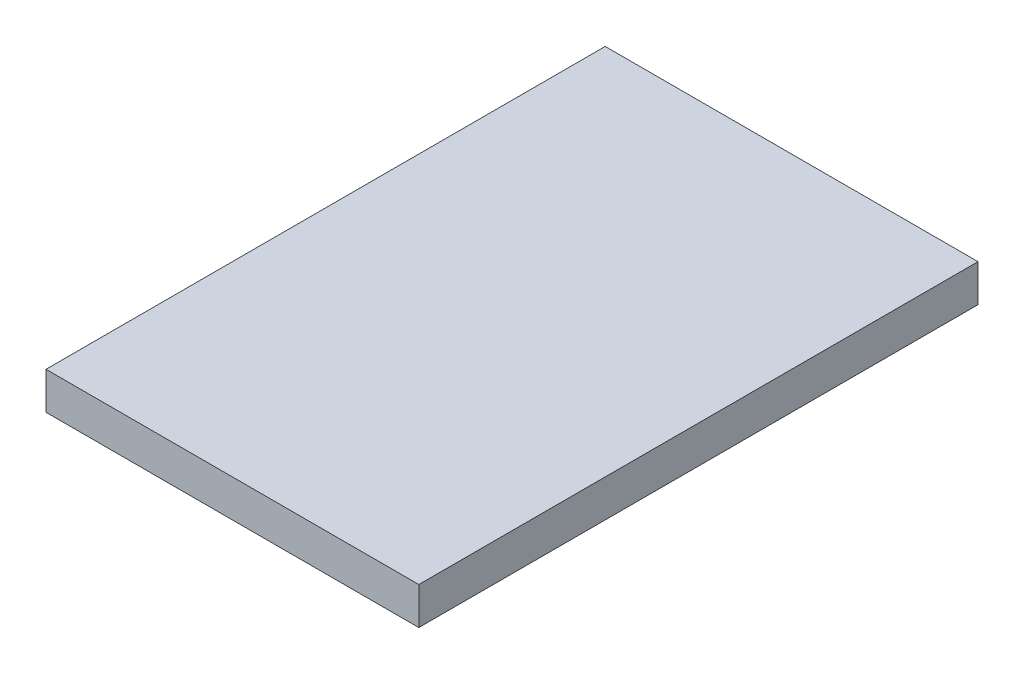
from build123d import *

# Parameters (mm, degrees)
SKETCH1_W            = 49
SKETCH1_H            = 101
BOSS_EXTRUDE1_DEPTH  = 1.5
SKETCH2_W            = 54
SKETCH2_H            = 106
SKETCH2_W_2          = 49
SKETCH2_H_2          = 101
BOSS_EXTRUDE2_DEPTH  = 4
BOSS_EXTRUDE3_DEPTH  = 4
SKETCH8_W            = 5
SKETCH8_H            = 15
BOSS_EXTRUDE4_DEPTH  = 3.5
FILLET3_R            = 4
FILLET3_OF_MIRROR1_R = 4
SKETCH4_R            = 1.75
CUT_EXTRUDE1_DEPTH   = 1
SKETCH5_R            = 1.75
CUT_EXTRUDE2_DEPTH   = 1
FILLET1_R            = 3
FILLET2_R            = 10
CHAMFER1_SIZE        = 1
CHAMFER2_SIZE        = 1
FILLET4_R            = 2
FILLET6_R            = 4
FILLET5_R            = 1
SKETCH9_W            = 100
SKETCH9_H            = 150
BOSS_EXTRUDE5_DEPTH  = 10
SCALE1_SCALE         = 0.99
CHAMFER3_SIZE        = 3


# Some blends are built 0.0001 mm under size
with BuildPart() as part:
    # Sketch1 → Boss-Extrude1 (new body)
    with BuildSketch(Plane(origin=(0, 0, 0), x_dir=(1, 0, 0), z_dir=(0, 1, 0))):
        Rectangle(SKETCH1_W, SKETCH1_H)
    extrude(amount=BOSS_EXTRUDE1_DEPTH)

    # Sketch2 → Boss-Extrude2 (add)
    with BuildSketch(Plane(origin=(0, 0, 0), x_dir=(1, 0, 0), z_dir=(0, 1, 0))):
        Rectangle(SKETCH2_W, SKETCH2_H)
        Rectangle(SKETCH2_W_2, SKETCH2_H_2, mode=Mode.SUBTRACT)
    extrude(amount=BOSS_EXTRUDE2_DEPTH)

    # Sketch3 → Boss-Extrude3 (add)
    with BuildSketch(Plane(origin=(0, 0, 0), x_dir=(1, 0, 0), z_dir=(0, 1, 0))):
        with BuildLine():
            Line((-24.5, -30.741687605), (-24.5, -34.058312395))
            ThreePointArc((-24.5, -34.058312395), (-19, -32.4), (-24.5, -30.741687605))
        make_face()
        with BuildLine():
            Line((-24.5, -46.403337045), (-24.5, -50.5))
            Line((-24.5, -50.5), (-20.403337045, -50.5))
            ThreePointArc((-20.403337045, -50.5), (-19.778679656, -45.778679656), (-24.5, -46.403337045))
        make_face()
    boss_extrude3 = extrude(amount=BOSS_EXTRUDE3_DEPTH)

    # Sketch8 → Boss-Extrude4 (add)
    with BuildSketch(Plane(origin=(0, 1.5, 0), x_dir=(1, 0, 0), z_dir=(0, 1, 0))):
        with Locations((-12.25, 0)):
            Rectangle(SKETCH8_W, SKETCH8_H)
    boss_extrude4 = extrude(amount=BOSS_EXTRUDE4_DEPTH)

    # Fillet3
    # the kernel refuses this fillet: 4 mm, written as the material it adds along each edge
    with BuildSketch(Plane(origin=(-14.75, 1.5, -7.5), x_dir=(0, 0, -1), z_dir=(1, 0, 0)), Plane(origin=(-9.75, 1.5, 7.5), x_dir=(0, 0, 1), z_dir=(-1, 0, 0))) as fillet3_piece_1:
        with BuildLine():
            CenterArc((3.968626967, 4), FILLET3_R, 187.180755781, 82.819244219)
            Line((0, 3.5), (-0.079372539, 3.49))
            ThreePointArc((-0.079372539, 3.49), (-0.08, 1.75), (-0.08, 0))
            Line((-0.08, 0), (0, -0.08))
            Line((0, -0.08), (3.968626967, -0.08))
            Line((3.968626967, -0.08), (3.968626967, 0))
        make_face()
    extrude(amount=5)
    with BuildSketch(Plane(origin=(-9.75, 1.5, -7.5), x_dir=(1, 0, 0), z_dir=(0, 0, 1)), Plane(origin=(-14.75, 1.5, 7.5), x_dir=(-1, 0, 0), z_dir=(0, 0, -1))) as fillet3_piece_2:
        with BuildLine():
            CenterArc((3.968626967, 4), FILLET3_R, 187.180755781, 82.819244219)
            Line((0, 3.5), (-0.079372539, 3.49))
            ThreePointArc((-0.079372539, 3.49), (-0.08, 1.75), (-0.08, 0))
            Line((-0.08, 0), (0, -0.08))
            Line((0, -0.08), (3.968626967, -0.08))
            Line((3.968626967, -0.08), (3.968626967, 0))
        make_face()
    extrude(amount=15)
    with BuildSketch(Plane(origin=(-14.75, 1.5, 7.5), x_dir=(-1, 0, 0), z_dir=(0, 0, -1))) as fillet3_piece_3a_section:
        with BuildLine():
            CenterArc((3.968626967, 4), FILLET3_R, 187.180755781, 82.819244219)
            Line((0, 3.5), (-0.079372539, 3.49))
            ThreePointArc((-0.079372539, 3.49), (-0.08, 1.75), (-0.08, 0))
            Line((-0.08, 0), (0, -0.08))
            Line((0, -0.08), (3.968626967, -0.08))
            Line((3.968626967, -0.08), (3.968626967, 0))
        make_face()
    fillet3_piece_3a = extrude(amount=24.921567416, mode=Mode.PRIVATE)
    fillet3_piece_3a = split(fillet3_piece_3a, bisect_by=Plane(origin=(-15.663794772, 2.350141375, -7.5), z_dir=(0, 0, -1)), keep=Keep.TOP, mode=Mode.PRIVATE)
    with BuildSketch(Plane(origin=(-24.671567416, 1.5, -7.5), x_dir=(0, 0, -1), z_dir=(1, 0, 0))) as fillet3_piece_3b_section:
        with BuildLine():
            CenterArc((3.968626967, 4), FILLET3_R, 187.180755781, 82.819244219)
            Line((0, 3.5), (-0.079372539, 3.49))
            ThreePointArc((-0.079372539, 3.49), (-0.08, 1.75), (-0.08, 0))
            Line((-0.08, 0), (0, -0.08))
            Line((0, -0.08), (3.968626967, -0.08))
            Line((3.968626967, -0.08), (3.968626967, 0))
        make_face()
    fillet3_piece_3b = extrude(amount=14.921567416, mode=Mode.PRIVATE)
    fillet3_piece_3b = split(fillet3_piece_3b, bisect_by=Plane(origin=(-14.75, 2.350141375, -8.413794772), z_dir=(-1, 0, 0)), keep=Keep.TOP, mode=Mode.PRIVATE)
    fillet3_piece_3 = fillet3_piece_3a & fillet3_piece_3b
    add(fillet3_piece_3)
    with BuildSketch(Plane(origin=(-9.75, 1.5, -17.421567416), x_dir=(1, 0, 0), z_dir=(0, 0, 1))) as fillet3_piece_4a_section:
        with BuildLine():
            CenterArc((3.968626967, 4), FILLET3_R, 187.180755781, 82.819244219)
            Line((0, 3.5), (-0.079372539, 3.49))
            ThreePointArc((-0.079372539, 3.49), (-0.08, 1.75), (-0.08, 0))
            Line((-0.08, 0), (0, -0.08))
            Line((0, -0.08), (3.968626967, -0.08))
            Line((3.968626967, -0.08), (3.968626967, 0))
        make_face()
    fillet3_piece_4a = extrude(amount=24.921567416, mode=Mode.PRIVATE)
    fillet3_piece_4a = split(fillet3_piece_4a, bisect_by=Plane(origin=(-8.836205228, 2.350141375, -7.5), z_dir=(0, 0, -1)), keep=Keep.TOP, mode=Mode.PRIVATE)
    with BuildSketch(Plane(origin=(-14.75, 1.5, -7.5), x_dir=(0, 0, -1), z_dir=(1, 0, 0))) as fillet3_piece_4b_section:
        with BuildLine():
            CenterArc((3.968626967, 4), FILLET3_R, 187.180755781, 82.819244219)
            Line((0, 3.5), (-0.079372539, 3.49))
            ThreePointArc((-0.079372539, 3.49), (-0.08, 1.75), (-0.08, 0))
            Line((-0.08, 0), (0, -0.08))
            Line((0, -0.08), (3.968626967, -0.08))
            Line((3.968626967, -0.08), (3.968626967, 0))
        make_face()
    fillet3_piece_4b = extrude(amount=14.921567416, mode=Mode.PRIVATE)
    fillet3_piece_4b = split(fillet3_piece_4b, bisect_by=Plane(origin=(-9.75, 2.350141375, -8.413794772), z_dir=(1, 0, 0)), keep=Keep.TOP, mode=Mode.PRIVATE)
    fillet3_piece_4 = fillet3_piece_4a & fillet3_piece_4b
    add(fillet3_piece_4)
    with BuildSketch(Plane(origin=(0.171567416, 1.5, 7.5), x_dir=(0, 0, 1), z_dir=(-1, 0, 0))) as fillet3_piece_5a_section:
        with BuildLine():
            CenterArc((3.968626967, 4), FILLET3_R, 187.180755781, 82.819244219)
            Line((0, 3.5), (-0.079372539, 3.49))
            ThreePointArc((-0.079372539, 3.49), (-0.08, 1.75), (-0.08, 0))
            Line((-0.08, 0), (0, -0.08))
            Line((0, -0.08), (3.968626967, -0.08))
            Line((3.968626967, -0.08), (3.968626967, 0))
        make_face()
    fillet3_piece_5a = extrude(amount=14.921567416, mode=Mode.PRIVATE)
    fillet3_piece_5a = split(fillet3_piece_5a, bisect_by=Plane(origin=(-9.75, 2.350141375, 8.413794772), z_dir=(1, 0, 0)), keep=Keep.TOP, mode=Mode.PRIVATE)
    with BuildSketch(Plane(origin=(-9.75, 1.5, -7.5), x_dir=(1, 0, 0), z_dir=(0, 0, 1))) as fillet3_piece_5b_section:
        with BuildLine():
            CenterArc((3.968626967, 4), FILLET3_R, 187.180755781, 82.819244219)
            Line((0, 3.5), (-0.079372539, 3.49))
            ThreePointArc((-0.079372539, 3.49), (-0.08, 1.75), (-0.08, 0))
            Line((-0.08, 0), (0, -0.08))
            Line((0, -0.08), (3.968626967, -0.08))
            Line((3.968626967, -0.08), (3.968626967, 0))
        make_face()
    fillet3_piece_5b = extrude(amount=24.921567416, mode=Mode.PRIVATE)
    fillet3_piece_5b = split(fillet3_piece_5b, bisect_by=Plane(origin=(-8.836205228, 2.350141375, 7.5), z_dir=(0, 0, 1)), keep=Keep.TOP, mode=Mode.PRIVATE)
    fillet3_piece_5 = fillet3_piece_5a & fillet3_piece_5b
    add(fillet3_piece_5)
    with BuildSketch(Plane(origin=(-14.75, 1.5, 17.421567416), x_dir=(-1, 0, 0), z_dir=(0, 0, -1))) as fillet3_piece_6a_section:
        with BuildLine():
            CenterArc((3.968626967, 4), FILLET3_R, 187.180755781, 82.819244219)
            Line((0, 3.5), (-0.079372539, 3.49))
            ThreePointArc((-0.079372539, 3.49), (-0.08, 1.75), (-0.08, 0))
            Line((-0.08, 0), (0, -0.08))
            Line((0, -0.08), (3.968626967, -0.08))
            Line((3.968626967, -0.08), (3.968626967, 0))
        make_face()
    fillet3_piece_6a = extrude(amount=24.921567416, mode=Mode.PRIVATE)
    fillet3_piece_6a = split(fillet3_piece_6a, bisect_by=Plane(origin=(-15.663794772, 2.350141375, 7.5), z_dir=(0, 0, 1)), keep=Keep.TOP, mode=Mode.PRIVATE)
    with BuildSketch(Plane(origin=(-9.75, 1.5, 7.5), x_dir=(0, 0, 1), z_dir=(-1, 0, 0))) as fillet3_piece_6b_section:
        with BuildLine():
            CenterArc((3.968626967, 4), FILLET3_R, 187.180755781, 82.819244219)
            Line((0, 3.5), (-0.079372539, 3.49))
            ThreePointArc((-0.079372539, 3.49), (-0.08, 1.75), (-0.08, 0))
            Line((-0.08, 0), (0, -0.08))
            Line((0, -0.08), (3.968626967, -0.08))
            Line((3.968626967, -0.08), (3.968626967, 0))
        make_face()
    fillet3_piece_6b = extrude(amount=14.921567416, mode=Mode.PRIVATE)
    fillet3_piece_6b = split(fillet3_piece_6b, bisect_by=Plane(origin=(-14.75, 2.350141375, 8.413794772), z_dir=(-1, 0, 0)), keep=Keep.TOP, mode=Mode.PRIVATE)
    fillet3_piece_6 = fillet3_piece_6a & fillet3_piece_6b
    add(fillet3_piece_6)

    # Mirror1: Boss-Extrude3, Boss-Extrude4 across plane
    add(boss_extrude3.mirror(Plane(origin=(0, 0, 0), x_dir=(0, 0, 1), z_dir=(1, 0, 0))))
    add(boss_extrude4.mirror(Plane(origin=(0, 0, 0), x_dir=(0, 0, 1), z_dir=(1, 0, 0))))

    # Fillet3 of Mirror1
    # the kernel refuses this fillet: 4 mm, written as the material it adds along each edge
    with BuildSketch(Plane(origin=(14.75, 1.5, -7.5), x_dir=(0, 0, -1), z_dir=(-1, 0, 0)), Plane(origin=(9.75, 1.5, 7.5), x_dir=(0, 0, 1), z_dir=(1, 0, 0))) as fillet3_of_mirror1_piece_1:
        with BuildLine():
            CenterArc((3.968626967, -4), FILLET3_OF_MIRROR1_R, 90, 82.819244219)
            Line((0, -3.5), (-0.079372539, -3.49))
            ThreePointArc((-0.079372539, -3.49), (-0.08, -1.75), (-0.08, 0))
            Line((-0.08, 0), (0, 0.08))
            Line((0, 0.08), (3.968626967, 0.08))
            Line((3.968626967, 0.08), (3.968626967, 0))
        make_face()
    extrude(amount=5)
    with BuildSketch(Plane(origin=(9.75, 1.5, -7.5), x_dir=(-1, 0, 0), z_dir=(0, 0, 1)), Plane(origin=(14.75, 1.5, 7.5), x_dir=(1, 0, 0), z_dir=(0, 0, -1))) as fillet3_of_mirror1_piece_2:
        with BuildLine():
            CenterArc((3.968626967, -4), FILLET3_OF_MIRROR1_R, 90, 82.819244219)
            Line((0, -3.5), (-0.079372539, -3.49))
            ThreePointArc((-0.079372539, -3.49), (-0.08, -1.75), (-0.08, 0))
            Line((-0.08, 0), (0, 0.08))
            Line((0, 0.08), (3.968626967, 0.08))
            Line((3.968626967, 0.08), (3.968626967, 0))
        make_face()
    extrude(amount=15)
    with BuildSketch(Plane(origin=(24.671567416, 1.5, -7.5), x_dir=(0, 0, -1), z_dir=(-1, 0, 0))) as fillet3_of_mirror1_piece_3a_section:
        with BuildLine():
            CenterArc((3.968626967, -4), FILLET3_OF_MIRROR1_R, 90, 82.819244219)
            Line((0, -3.5), (-0.079372539, -3.49))
            ThreePointArc((-0.079372539, -3.49), (-0.08, -1.75), (-0.08, 0))
            Line((-0.08, 0), (0, 0.08))
            Line((0, 0.08), (3.968626967, 0.08))
            Line((3.968626967, 0.08), (3.968626967, 0))
        make_face()
    fillet3_of_mirror1_piece_3a = extrude(amount=14.921567416, mode=Mode.PRIVATE)
    fillet3_of_mirror1_piece_3a = split(fillet3_of_mirror1_piece_3a, bisect_by=Plane(origin=(14.75, 2.350141375, -8.413794772), z_dir=(1, 0, 0)), keep=Keep.TOP, mode=Mode.PRIVATE)
    with BuildSketch(Plane(origin=(14.75, 1.5, 7.5), x_dir=(1, 0, 0), z_dir=(0, 0, -1))) as fillet3_of_mirror1_piece_3b_section:
        with BuildLine():
            CenterArc((3.968626967, -4), FILLET3_OF_MIRROR1_R, 90, 82.819244219)
            Line((0, -3.5), (-0.079372539, -3.49))
            ThreePointArc((-0.079372539, -3.49), (-0.08, -1.75), (-0.08, 0))
            Line((-0.08, 0), (0, 0.08))
            Line((0, 0.08), (3.968626967, 0.08))
            Line((3.968626967, 0.08), (3.968626967, 0))
        make_face()
    fillet3_of_mirror1_piece_3b = extrude(amount=24.921567416, mode=Mode.PRIVATE)
    fillet3_of_mirror1_piece_3b = split(fillet3_of_mirror1_piece_3b, bisect_by=Plane(origin=(15.663794772, 2.350141375, -7.5), z_dir=(0, 0, -1)), keep=Keep.TOP, mode=Mode.PRIVATE)
    fillet3_of_mirror1_piece_3 = fillet3_of_mirror1_piece_3a & fillet3_of_mirror1_piece_3b
    add(fillet3_of_mirror1_piece_3)
    with BuildSketch(Plane(origin=(14.75, 1.5, -7.5), x_dir=(0, 0, -1), z_dir=(-1, 0, 0))) as fillet3_of_mirror1_piece_4a_section:
        with BuildLine():
            CenterArc((3.968626967, -4), FILLET3_OF_MIRROR1_R, 90, 82.819244219)
            Line((0, -3.5), (-0.079372539, -3.49))
            ThreePointArc((-0.079372539, -3.49), (-0.08, -1.75), (-0.08, 0))
            Line((-0.08, 0), (0, 0.08))
            Line((0, 0.08), (3.968626967, 0.08))
            Line((3.968626967, 0.08), (3.968626967, 0))
        make_face()
    fillet3_of_mirror1_piece_4a = extrude(amount=14.921567416, mode=Mode.PRIVATE)
    fillet3_of_mirror1_piece_4a = split(fillet3_of_mirror1_piece_4a, bisect_by=Plane(origin=(9.75, 2.350141375, -8.413794772), z_dir=(-1, 0, 0)), keep=Keep.TOP, mode=Mode.PRIVATE)
    with BuildSketch(Plane(origin=(9.75, 1.5, -17.421567416), x_dir=(-1, 0, 0), z_dir=(0, 0, 1))) as fillet3_of_mirror1_piece_4b_section:
        with BuildLine():
            CenterArc((3.968626967, -4), FILLET3_OF_MIRROR1_R, 90, 82.819244219)
            Line((0, -3.5), (-0.079372539, -3.49))
            ThreePointArc((-0.079372539, -3.49), (-0.08, -1.75), (-0.08, 0))
            Line((-0.08, 0), (0, 0.08))
            Line((0, 0.08), (3.968626967, 0.08))
            Line((3.968626967, 0.08), (3.968626967, 0))
        make_face()
    fillet3_of_mirror1_piece_4b = extrude(amount=24.921567416, mode=Mode.PRIVATE)
    fillet3_of_mirror1_piece_4b = split(fillet3_of_mirror1_piece_4b, bisect_by=Plane(origin=(8.836205228, 2.350141375, -7.5), z_dir=(0, 0, -1)), keep=Keep.TOP, mode=Mode.PRIVATE)
    fillet3_of_mirror1_piece_4 = fillet3_of_mirror1_piece_4a & fillet3_of_mirror1_piece_4b
    add(fillet3_of_mirror1_piece_4)
    with BuildSketch(Plane(origin=(9.75, 1.5, -7.5), x_dir=(-1, 0, 0), z_dir=(0, 0, 1))) as fillet3_of_mirror1_piece_5a_section:
        with BuildLine():
            CenterArc((3.968626967, -4), FILLET3_OF_MIRROR1_R, 90, 82.819244219)
            Line((0, -3.5), (-0.079372539, -3.49))
            ThreePointArc((-0.079372539, -3.49), (-0.08, -1.75), (-0.08, 0))
            Line((-0.08, 0), (0, 0.08))
            Line((0, 0.08), (3.968626967, 0.08))
            Line((3.968626967, 0.08), (3.968626967, 0))
        make_face()
    fillet3_of_mirror1_piece_5a = extrude(amount=24.921567416, mode=Mode.PRIVATE)
    fillet3_of_mirror1_piece_5a = split(fillet3_of_mirror1_piece_5a, bisect_by=Plane(origin=(8.836205228, 2.350141375, 7.5), z_dir=(0, 0, 1)), keep=Keep.TOP, mode=Mode.PRIVATE)
    with BuildSketch(Plane(origin=(-0.171567416, 1.5, 7.5), x_dir=(0, 0, 1), z_dir=(1, 0, 0))) as fillet3_of_mirror1_piece_5b_section:
        with BuildLine():
            CenterArc((3.968626967, -4), FILLET3_OF_MIRROR1_R, 90, 82.819244219)
            Line((0, -3.5), (-0.079372539, -3.49))
            ThreePointArc((-0.079372539, -3.49), (-0.08, -1.75), (-0.08, 0))
            Line((-0.08, 0), (0, 0.08))
            Line((0, 0.08), (3.968626967, 0.08))
            Line((3.968626967, 0.08), (3.968626967, 0))
        make_face()
    fillet3_of_mirror1_piece_5b = extrude(amount=14.921567416, mode=Mode.PRIVATE)
    fillet3_of_mirror1_piece_5b = split(fillet3_of_mirror1_piece_5b, bisect_by=Plane(origin=(9.75, 2.350141375, 8.413794772), z_dir=(-1, 0, 0)), keep=Keep.TOP, mode=Mode.PRIVATE)
    fillet3_of_mirror1_piece_5 = fillet3_of_mirror1_piece_5a & fillet3_of_mirror1_piece_5b
    add(fillet3_of_mirror1_piece_5)
    with BuildSketch(Plane(origin=(9.75, 1.5, 7.5), x_dir=(0, 0, 1), z_dir=(1, 0, 0))) as fillet3_of_mirror1_piece_6a_section:
        with BuildLine():
            CenterArc((3.968626967, -4), FILLET3_OF_MIRROR1_R, 90, 82.819244219)
            Line((0, -3.5), (-0.079372539, -3.49))
            ThreePointArc((-0.079372539, -3.49), (-0.08, -1.75), (-0.08, 0))
            Line((-0.08, 0), (0, 0.08))
            Line((0, 0.08), (3.968626967, 0.08))
            Line((3.968626967, 0.08), (3.968626967, 0))
        make_face()
    fillet3_of_mirror1_piece_6a = extrude(amount=14.921567416, mode=Mode.PRIVATE)
    fillet3_of_mirror1_piece_6a = split(fillet3_of_mirror1_piece_6a, bisect_by=Plane(origin=(14.75, 2.350141375, 8.413794772), z_dir=(1, 0, 0)), keep=Keep.TOP, mode=Mode.PRIVATE)
    with BuildSketch(Plane(origin=(14.75, 1.5, 17.421567416), x_dir=(1, 0, 0), z_dir=(0, 0, -1))) as fillet3_of_mirror1_piece_6b_section:
        with BuildLine():
            CenterArc((3.968626967, -4), FILLET3_OF_MIRROR1_R, 90, 82.819244219)
            Line((0, -3.5), (-0.079372539, -3.49))
            ThreePointArc((-0.079372539, -3.49), (-0.08, -1.75), (-0.08, 0))
            Line((-0.08, 0), (0, 0.08))
            Line((0, 0.08), (3.968626967, 0.08))
            Line((3.968626967, 0.08), (3.968626967, 0))
        make_face()
    fillet3_of_mirror1_piece_6b = extrude(amount=24.921567416, mode=Mode.PRIVATE)
    fillet3_of_mirror1_piece_6b = split(fillet3_of_mirror1_piece_6b, bisect_by=Plane(origin=(15.663794772, 2.350141375, 7.5), z_dir=(0, 0, 1)), keep=Keep.TOP, mode=Mode.PRIVATE)
    fillet3_of_mirror1_piece_6 = fillet3_of_mirror1_piece_6a & fillet3_of_mirror1_piece_6b
    add(fillet3_of_mirror1_piece_6)

    # Sketch4 → Cut-Extrude1 (cut)
    with BuildSketch(Plane(origin=(0, 4, 0), x_dir=(1, 0, 0), z_dir=(0, 1, 0))):
        with Locations(Location((-21.9, -47.9, 0), (0, 0, 270))):
            Circle(SKETCH4_R)
        with Locations(Location((21.9, -47.9, 0), (0, 0, 270))):
            Circle(SKETCH4_R)
    extrude(amount=-CUT_EXTRUDE1_DEPTH, mode=Mode.SUBTRACT)

    # Sketch5 → Cut-Extrude2 (cut)
    with BuildSketch(Plane(origin=(0, 4, 0), x_dir=(1, 0, 0), z_dir=(0, 1, 0))):
        with Locations(Location((-22, -32.4, 0), (0, 0, 270))):
            Circle(SKETCH5_R)
        with Locations(Location((22, -32.4, 0), (0, 0, 270))):
            Circle(SKETCH5_R)
    extrude(amount=-CUT_EXTRUDE2_DEPTH, mode=Mode.SUBTRACT)

    # Fillet1
    fillet1_edges = [part.edges().sort_by_distance(p)[0] for p in [
        (-27, 2, 53),
        (27, 2, 53),
        (27, 2, -53),
        (-27, 2, -53),
    ]]
    fillet(fillet1_edges, radius=FILLET1_R)

    # Fillet2
    fillet2_edges = [part.edges().sort_by_distance(p)[0] for p in [
        (24.5, 2.75, 34.058312395),
        (24.5, 2.75, 30.741687605),
        (-24.5, 2.75, 34.058312395),
        (-24.5, 2.75, 30.741687605),
    ]]
    fillet(fillet2_edges, radius=FILLET2_R)

    # Chamfer1
    chamfer1_edges = [part.edges().sort_by_distance(p)[0] for p in [
        (-22, 3, 30.65),
        (22, 3, 30.65),
    ]]
    chamfer(chamfer1_edges, length=CHAMFER1_SIZE - 0.0001)  # a hair under: the kernel refuses the full size

    # Chamfer2
    chamfer2_edges = [part.edges().sort_by_distance(p)[0] for p in [
        (-21.9, 3, 46.15),
        (21.9, 3, 46.15),
    ]]
    chamfer(chamfer2_edges, length=CHAMFER2_SIZE - 0.0001)  # a hair under: the kernel refuses the full size

    # Fillet4
    fillet4_edges = [part.edges().sort_by_distance(p)[0] for p in [
        (24.5, 2.75, 46.403337045),
        (20.403337045, 2.75, 50.5),
        (-20.403337045, 2.75, 50.5),
        (-24.5, 2.75, 46.403337045),
    ]]
    fillet(fillet4_edges, radius=FILLET4_R)

    # Fillet6
    fillet6_edges = [part.edges().sort_by_distance(p)[0] for p in [
        (24.5, 2.75, -50.5),
        (-24.5, 2.75, -50.5),
    ]]
    fillet(fillet6_edges, radius=FILLET6_R)

    # Fillet5
    fillet5_edges = [part.edges().sort_by_distance(p)[0] for p in [
        (19, 1.5, 32.4),
        (24.5, 1.5, -12.359190145),
        (-19, 1.5, 32.4),
        (-23.355759821, 1.5, 38.373434867),
        (-23.379535677, 1.5, 26.380950764),
        (23.379535677, 1.5, 26.380950764),
        (19.778589199, 1.5, 45.778770118),
        (-19.778589199, 1.5, 45.778770118),
        (0, 1.5, 50.5),
        (23.355759821, 1.5, 38.373434867),
        (-23.833971189, 1.5, 44.42584152),
        (-18.432793496, 1.5, 49.826649916),
        (18.432793496, 1.5, 49.826649916),
        (23.833971189, 1.5, 44.42584152),
        (0, 1.5, -50.5),
        (-24.5, 1.5, -12.359190145),
        (-23.328427125, 1.5, -49.328427125),
        (23.328427125, 1.5, -49.328427125),
    ]]
    fillet(fillet5_edges, radius=FILLET5_R)


with BuildPart() as body_2:
    # Sketch9 → Boss-Extrude5 (new body)
    with BuildSketch(Plane(origin=(0, 0, 0), x_dir=(1, 0, 0), z_dir=(0, 1, 0))):
        Rectangle(SKETCH9_W, SKETCH9_H)
    extrude(amount=BOSS_EXTRUDE5_DEPTH)

    # Combine1: cut part
    add(part.part, mode=Mode.SUBTRACT)


with BuildPart() as body_2_1:
    # Scale1: scaled about (0, 5.315427328, -0.095147198)
    add(body_2.part.scale(SCALE1_SCALE).moved(Location((0, 0.053154273, -0.000951472))))

    # Chamfer3
    chamfer3_edges = [body_2_1.edges().sort_by_distance(p)[0] for p in [
        (0, 0.053154273, 52.469048528),
        (26.73, 0.053154273, -0.000951472),
        (0, 0.053154273, -52.470951472),
        (-26.73, 0.053154273, -0.000951472),
        (-25.86010714, 0.053154273, 51.599155668),
        (-25.86010714, 0.053154273, -51.601058612),
        (25.86010714, 0.053154273, -51.601058612),
        (25.86010714, 0.053154273, 51.599155668),
    ]]
    chamfer(chamfer3_edges, length=CHAMFER3_SIZE)


solid = body_2_1.part
